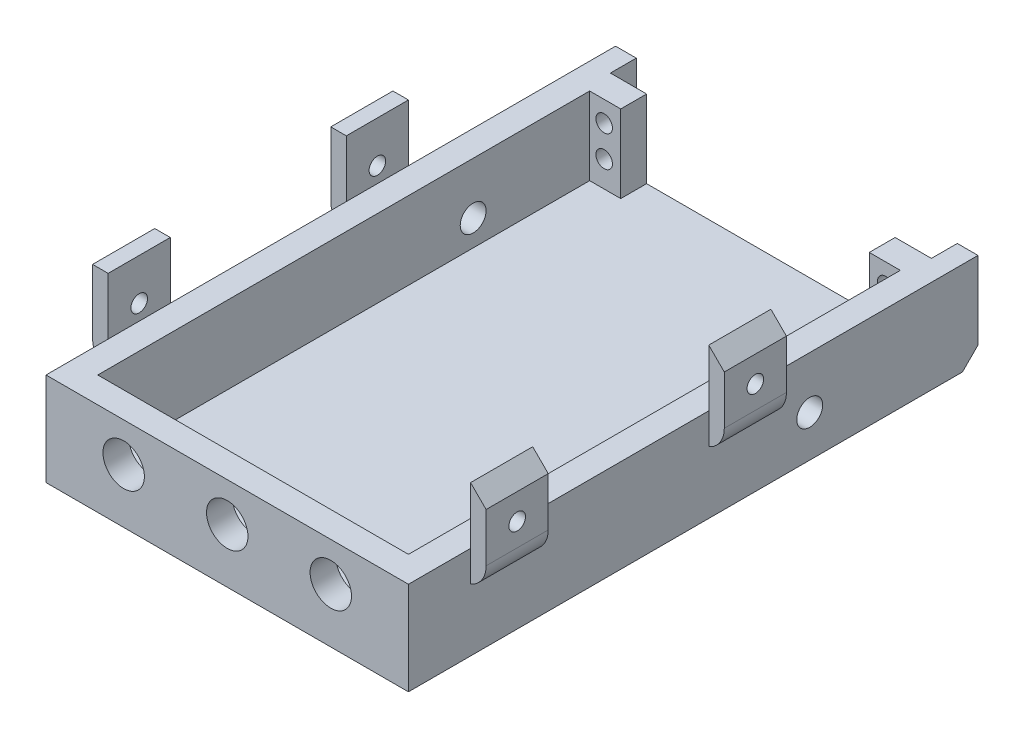
from build123d import *

# Parameters (mm, degrees)
CROQUIS1_W               = 70
CROQUIS1_H               = 105
SALIENTE_EXTRUIR1_DEPTH  = 3
SALIENTE_EXTRUIR2_DEPTH  = 15
CROQUIS10_R              = 1.6
CROQUIS10_W              = 3
CROQUIS10_H              = 6
CROQUIS10_H_2            = 11
SALIENTE_EXTRUIR4_DEPTH  = 3
REDONDEO1_R              = 5
REDONDEO1_OF_SIMETR_A1_R = 5
CROQUIS12_W              = 5
CROQUIS12_H              = 15
SALIENTE_EXTRUIR5_DEPTH  = 6
CORTAR_EXTRUIR1_REACH    = 117.369
CROQUIS13_R              = 4
CORTAR_EXTRUIR2_REACH    = 117.369
CROQUIS14_R              = 1.6
CROQUIS16_R              = 2.5
CORTAR_EXTRUIR3_DEPTH    = 70
CROQUIS17_W              = 4
CROQUIS17_H              = 5
SALIENTE_EXTRUIR6_DEPTH  = 18
CHAFL_N1_SIZE            = 3
CHAFL_N2_SIZE            = 3


# Some blends are built 0.0001 mm under size
with BuildPart() as part:
    # Croquis1 → Saliente-Extruir1 (new body)
    with BuildSketch(Plane(origin=(0, 0, 0), x_dir=(1, 0, 0), z_dir=(0, 1, 0))):
        Rectangle(CROQUIS1_W, CROQUIS1_H)
    extrude(amount=SALIENTE_EXTRUIR1_DEPTH)

    # Croquis2 → Saliente-Extruir2 (add)
    with BuildSketch(Plane(origin=(0, 3, 0), x_dir=(1, 0, 0), z_dir=(0, 1, 0))):
        Polygon((-35, 52.5), (-30, 52.5), (-30, -47.5), (30, -47.5), (30, 52.5), (35, 52.5), (35, -52.5), (-35, -52.5), align=None)
    extrude(amount=SALIENTE_EXTRUIR2_DEPTH)

    # Croquis10 → Saliente-Extruir4 (add)
    # profile 1 of 6: a face of its own
    with BuildSketch(Plane(origin=(35, 0, 0), x_dir=(0, 0, -1), z_dir=(1, 0, 0))):
        Polygon((8.5, 29), (8.5, 18), (17.5, 18), (17.5, 29), (11.5, 29), align=None)
        with Locations((11.5, 21)):
            Circle(CROQUIS10_R, mode=Mode.SUBTRACT)
    # profile 2 of 6: a face of its own
    with BuildSketch(Plane(origin=(35, 0, 0), x_dir=(0, 0, -1), z_dir=(1, 0, 0))):
        Polygon((8.5, 18), (8.5, 12), (11.5, 12), (17.5, 12), (17.5, 18), align=None)
    # profile 3 of 6: a face of its own
    with BuildSketch(Plane(origin=(35, 0, 0), x_dir=(0, 0, -1), z_dir=(1, 0, 0))):
        with Locations((7, 15)):
            Rectangle(CROQUIS10_W, CROQUIS10_H)
    # profile 4 of 6: a face of its own
    with BuildSketch(Plane(origin=(35, 0, 0), x_dir=(0, 0, -1), z_dir=(1, 0, 0))):
        with Locations((7, 23.5)):
            Rectangle(CROQUIS10_W, CROQUIS10_H_2)
    # profile 5 of 6: a face of its own
    with BuildSketch(Plane(origin=(35, 0, 0), x_dir=(0, 0, -1), z_dir=(1, 0, 0))):
        Polygon((-40.5, 18), (-28.5, 18), (-28.5, 29), (-31.5, 29), (-34.5, 29), (-40.5, 29), align=None)
        with Locations((-34.5, 21)):
            Circle(CROQUIS10_R, mode=Mode.SUBTRACT)
    # profile 6 of 6: a face of its own
    with BuildSketch(Plane(origin=(35, 0, 0), x_dir=(0, 0, -1), z_dir=(1, 0, 0))):
        Polygon((-28.5, 12), (-28.5, 18), (-40.5, 18), (-40.5, 12), (-34.5, 12), (-31.5, 12), align=None)
    saliente_extruir4 = extrude(amount=SALIENTE_EXTRUIR4_DEPTH)

    # Redondeo1
    # the kernel refuses this fillet: 5 mm, written as the material it takes off along each edge
    with BuildSketch(Plane(origin=(38, 12, 5.956439237), x_dir=(-1, 0, 0), z_dir=(0, 0, -1))) as redondeo1_piece_1:
        with BuildLine():
            CenterArc((5, 4.582575695), REDONDEO1_R, 180, 66.421821522)
            Line((0, 4.582575695), (-0.1, 4.582575695))
            Line((-0.1, 4.582575695), (-0.1, 0))
            Line((-0.1, 0), (0, -0.1))
            ThreePointArc((0, -0.1), (1.5, -0.1), (2.96, -0.091651514))
            Line((2.96, -0.091651514), (3, 0))
        make_face()
    extrude(amount=34.912878475, mode=Mode.SUBTRACT)
    with BuildSketch(Plane(origin=(38, 12, 17.043560763), x_dir=(-1, 0, 0), z_dir=(0, 0, 1))) as redondeo1_piece_2:
        with BuildLine():
            CenterArc((5, -4.582575695), REDONDEO1_R, 113.578178478, 66.421821522)
            Line((0, -4.582575695), (-0.1, -4.582575695))
            Line((-0.1, -4.582575695), (-0.1, 0))
            Line((-0.1, 0), (0, 0.1))
            ThreePointArc((0, 0.1), (1.5, 0.1), (2.96, 0.091651514))
            Line((2.96, 0.091651514), (3, 0))
        make_face()
    extrude(amount=34.912878475, mode=Mode.SUBTRACT)

    # Simetría1: Saliente-Extruir4 across plane
    add(saliente_extruir4.mirror(Plane(origin=(0, 0, 0), x_dir=(0, 0, 1), z_dir=(1, 0, 0))))

    # Redondeo1 of Simetría1
    # the kernel refuses this fillet: 5 mm, written as the material it takes off along each edge
    with BuildSketch(Plane(origin=(-38, 12, 5.956439237), x_dir=(1, 0, 0), z_dir=(0, 0, -1))) as redondeo1_of_simetr_a1_piece_1:
        with BuildLine():
            CenterArc((5, -4.582575695), REDONDEO1_OF_SIMETR_A1_R, 113.578178478, 66.421821522)
            Line((0, -4.582575695), (-0.1, -4.582575695))
            Line((-0.1, -4.582575695), (-0.1, 0))
            Line((-0.1, 0), (0, 0.1))
            ThreePointArc((0, 0.1), (1.5, 0.1), (2.96, 0.091651514))
            Line((2.96, 0.091651514), (3, 0))
        make_face()
    extrude(amount=34.912878475, mode=Mode.SUBTRACT)
    with BuildSketch(Plane(origin=(-38, 12, 17.043560763), x_dir=(1, 0, 0), z_dir=(0, 0, 1))) as redondeo1_of_simetr_a1_piece_2:
        with BuildLine():
            CenterArc((5, 4.582575695), REDONDEO1_OF_SIMETR_A1_R, 180, 66.421821522)
            Line((0, 4.582575695), (-0.1, 4.582575695))
            Line((-0.1, 4.582575695), (-0.1, 0))
            Line((-0.1, 0), (0, -0.1))
            ThreePointArc((0, -0.1), (1.5, -0.1), (2.96, -0.091651514))
            Line((2.96, -0.091651514), (3, 0))
        make_face()
    extrude(amount=34.912878475, mode=Mode.SUBTRACT)

    # Croquis12 → Saliente-Extruir5 (add)
    with BuildSketch(Plane(origin=(-30, 0, 0), x_dir=(0, 0, -1), z_dir=(1, 0, 0))):
        with Locations((50, 10.5)):
            Rectangle(CROQUIS12_W, CROQUIS12_H)
    saliente_extruir5 = extrude(amount=SALIENTE_EXTRUIR5_DEPTH)

    # Simetría2: Saliente-Extruir5 across plane
    add(saliente_extruir5.mirror(Plane(origin=(0, 0, 0), x_dir=(0, 0, 1), z_dir=(1, 0, 0))))

    # Croquis13 → Cortar-Extruir1 (cut, up to next)
    with BuildSketch(Plane.XY.offset(52.5), mode=Mode.PRIVATE) as cortar_extruir1_sk1:
        with Locations((-20, 10.5)):
            Circle(CROQUIS13_R)
    cortar_extruir1_tool1 = extrude(cortar_extruir1_sk1.sketch, amount=-CORTAR_EXTRUIR1_REACH, mode=Mode.PRIVATE) & part.part
    # Croquis13 → Cortar-Extruir1 (cut, up to next)
    with BuildSketch(Plane.XY.offset(52.5), mode=Mode.PRIVATE) as cortar_extruir1_sk2:
        with Locations((0, 10.5)):
            Circle(CROQUIS13_R)
    cortar_extruir1_tool2 = extrude(cortar_extruir1_sk2.sketch, amount=-CORTAR_EXTRUIR1_REACH, mode=Mode.PRIVATE) & part.part
    # Croquis13 → Cortar-Extruir1 (cut, up to next)
    with BuildSketch(Plane.XY.offset(52.5), mode=Mode.PRIVATE) as cortar_extruir1_sk3:
        with Locations((20, 10.5)):
            Circle(CROQUIS13_R)
    cortar_extruir1_tool3 = extrude(cortar_extruir1_sk3.sketch, amount=-CORTAR_EXTRUIR1_REACH, mode=Mode.PRIVATE) & part.part
    add(cortar_extruir1_tool1.solids().sort_by_distance((-20, 10.5, 52.5))[0], mode=Mode.SUBTRACT)
    add(cortar_extruir1_tool2.solids().sort_by_distance((0, 10.5, 52.5))[0], mode=Mode.SUBTRACT)
    add(cortar_extruir1_tool3.solids().sort_by_distance((20, 10.5, 52.5))[0], mode=Mode.SUBTRACT)

    # Croquis14 → Cortar-Extruir2 (cut, up to next)
    with BuildSketch(Plane(origin=(0, 0, -52.5), x_dir=(-1, 0, 0), z_dir=(0, 0, -1)), mode=Mode.PRIVATE) as cortar_extruir2_sk1:
        with Locations((27.2, 14)):
            Circle(CROQUIS14_R)
    cortar_extruir2_tool1 = extrude(cortar_extruir2_sk1.sketch, amount=-CORTAR_EXTRUIR2_REACH, mode=Mode.PRIVATE) & part.part
    # Croquis14 → Cortar-Extruir2 (cut, up to next)
    with BuildSketch(Plane(origin=(0, 0, -52.5), x_dir=(-1, 0, 0), z_dir=(0, 0, -1)), mode=Mode.PRIVATE) as cortar_extruir2_sk2:
        with Locations((27.2, 8)):
            Circle(CROQUIS14_R)
    cortar_extruir2_tool2 = extrude(cortar_extruir2_sk2.sketch, amount=-CORTAR_EXTRUIR2_REACH, mode=Mode.PRIVATE) & part.part
    cortar_extruir2_1 = cortar_extruir2_tool1.solids().sort_by_distance((-27.2, 14, -52.5))[0]
    add(cortar_extruir2_1, mode=Mode.SUBTRACT)
    cortar_extruir2_2 = cortar_extruir2_tool2.solids().sort_by_distance((-27.2, 8, -52.5))[0]
    add(cortar_extruir2_2, mode=Mode.SUBTRACT)
    cortar_extruir2 = cortar_extruir2_1 + cortar_extruir2_2  # Cortar-Extruir2 as one shape, for the pattern or mirror that repeats it

    # Simetría3: Cortar-Extruir2 across plane
    add(cortar_extruir2.mirror(Plane(origin=(0, 0, 0), x_dir=(0, 0, 1), z_dir=(1, 0, 0))), mode=Mode.SUBTRACT)

    # Croquis16 → Cortar-Extruir3 (cut)
    with BuildSketch(Plane.ZY.offset(35)):
        with Locations((-25, 8)):
            Circle(CROQUIS16_R)
    extrude(amount=-CORTAR_EXTRUIR3_DEPTH, mode=Mode.SUBTRACT)

    # Croquis17 → Saliente-Extruir6 (add)
    with BuildSketch(Plane(origin=(0, 0, 0), x_dir=(1, 0, 0), z_dir=(0, 1, 0))):
        with Locations((33, 55)):
            Rectangle(CROQUIS17_W, CROQUIS17_H)
    saliente_extruir6 = extrude(amount=SALIENTE_EXTRUIR6_DEPTH)

    # Simetría4: Saliente-Extruir6 across plane
    add(saliente_extruir6.mirror(Plane(origin=(0, 0, 0), x_dir=(0, 0, 1), z_dir=(1, 0, 0))))

    # Chaflán1
    chafl_n1_edges = [part.edges().sort_by_distance(p)[0] for p in [
        (33, 0, -57.5),
        (-33, 0, -57.5),
    ]]
    chamfer(chafl_n1_edges, length=CHAFL_N1_SIZE)

    # Chaflán2
    chafl_n2_edges = [part.edges().sort_by_distance(p)[0] for p in [
        (38, 29, -11.5),
        (38, 29, 34.5),
    ]]
    chamfer(chafl_n2_edges, length=CHAFL_N2_SIZE - 0.0001)  # a hair under: the kernel refuses the full size


solid = part.part
